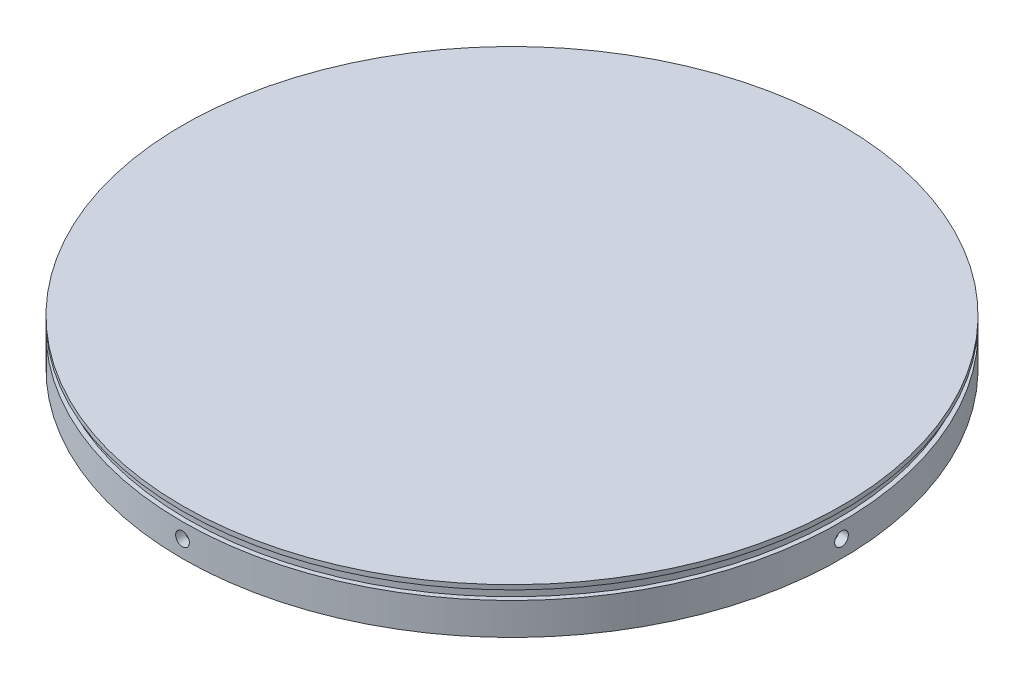
from build123d import *

# Parameters (mm, degrees)
SKETCH_9_R               = 72
SKETCH_9_R_2             = 70
EXTRUDE_9_DEPTH          = 10
SKETCH_9_18_R            = 70
SKETCH_9_18_R_2          = 66
EXTRUDE_10_DEPTH         = 2.5
SKETCH_9_19_R            = 66
EXTRUDE_11_DEPTH         = 10
SHELL_START              = -10
SHELL_2_OUTLINE_R        = 64
SHELL_2_DEPTH            = 8
F_3_0MM_1_REACH          = 163.118
F_3_0MM_1_BORE_R         = 1.5
PATTERN_CIRCULAR_1_COUNT = 4
SKETCH_15_W              = 1
SKETCH_15_H              = 2


# Read off the part's stored shape, not the designer's step: 薄殼2
with BuildPart() as part:
    # 草圖9 → 填料-伸長9 (new body)
    with BuildSketch(Plane(origin=(0, 0, 0), x_dir=(1, 0, 0), z_dir=(0, 1, 0))):
        with Locations(Location((0, 0, 0), (0, 0, 270))):
            Circle(SKETCH_9_R)
        with Locations(Location((0, 0, 0), (0, 0, 270))):
            Circle(SKETCH_9_R_2, mode=Mode.SUBTRACT)
    extrude(amount=-EXTRUDE_9_DEPTH)

    # 草圖9<18> → 填料-伸長10 (add)
    with BuildSketch(Plane(origin=(0, 0, 0), x_dir=(1, 0, 0), z_dir=(0, 1, 0))):
        with Locations(Location((0, 0, 0), (0, 0, 270))):
            Circle(SKETCH_9_18_R)
        with Locations(Location((0, 0, 0), (0, 0, 270))):
            Circle(SKETCH_9_18_R_2, mode=Mode.SUBTRACT)
    extrude(amount=-EXTRUDE_10_DEPTH)

    # 草圖9<19> → 填料-伸長11 (add)
    with BuildSketch(Plane(origin=(0, 0, 0), x_dir=(1, 0, 0), z_dir=(0, 1, 0))):
        with Locations(Location((0, 0, 0), (0, 0, 270))):
            Circle(SKETCH_9_19_R)
    extrude(amount=-EXTRUDE_11_DEPTH)

    # 薄殼2 outline → 薄殼2 (cut)
    with BuildSketch(Plane(origin=(0, 0, 0), x_dir=(1, 0, 0), z_dir=(0, 1, 0)).offset(SHELL_START)):
        Circle(SHELL_2_OUTLINE_R)
    extrude(amount=SHELL_2_DEPTH, mode=Mode.SUBTRACT)

    # Ø3.0mm 定位孔1 bore (on position points) → Ø3.0mm 定位孔1 (cut, up to next)
    with BuildSketch(Plane(origin=(0, -6.25, 72), x_dir=(1, 0, 0), z_dir=(0, 0, 1)), mode=Mode.PRIVATE) as f_3_0mm_1_sk1:
        Circle(F_3_0MM_1_BORE_R)
    f_3_0mm_1_tool1 = extrude(f_3_0mm_1_sk1.sketch, amount=-F_3_0MM_1_REACH, mode=Mode.PRIVATE) & part.part
    f_3_0mm_1 = f_3_0mm_1_tool1.solids().sort_by_distance((0, -6.25, 72))[0]
    add(f_3_0mm_1, mode=Mode.SUBTRACT)

    # 環狀複製排列1: Ø3.0mm 定位孔1 ×4 about axis
    pattern_circular_1_axis = Axis((0, -10, 0), (0, 1, 0))
    for i in range(1, PATTERN_CIRCULAR_1_COUNT):
        add(f_3_0mm_1.rotate(pattern_circular_1_axis, i * 360 / PATTERN_CIRCULAR_1_COUNT), mode=Mode.SUBTRACT)

    # 草圖15 → 除料-旋轉2 (revolve, cut)
    with BuildSketch(Plane(origin=(0, 0, 0), x_dir=(0, 0, -1), z_dir=(1, 0, 0))):
        with Locations((-71.5, -2)):
            Rectangle(SKETCH_15_W, SKETCH_15_H)
    revolve(axis=Axis((0, 0, 0), (0, -1, 0)), mode=Mode.SUBTRACT)


solid = part.part
